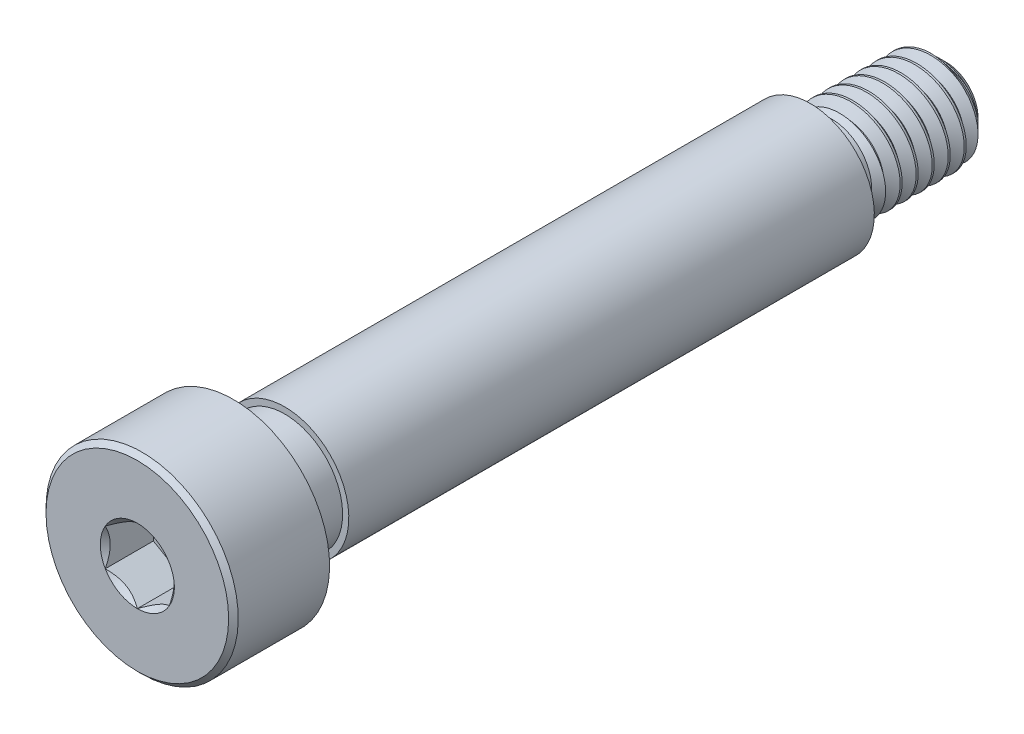
from build123d import *

# Parameters (mm, degrees)
CUT_REVOLVE_THIN1_START         = -8.379
CUT_REVOLVE_THIN1_OUTLINE_R     = 2
CUT_REVOLVE_THIN1_OUTLINE_R_2   = 1.807
CUT_REVOLVE_THIN1_DEPTH         = 16.4
CUT_REVOLVE_THIN1_2_OUTLINE_R   = 2
CUT_REVOLVE_THIN1_2_OUTLINE_R_2 = 1.797
CUT_REVOLVE_THIN1_2_DEPTH       = 16.4
CUT_EXTRUDE1_START              = 12.621
CUT_EXTRUDE1_DEPTH              = 1.5
CHAMFER2_SIZE                   = 0.506148016
CUT_SWEEP1_PITCH                = 0.5
CUT_SWEEP1_TO                   = 3.567136


with BuildPart() as part:
    # Sketch3 → Revolve1 (revolve)
    with BuildSketch(Plane(origin=(0, 0, 0), x_dir=(0, 0, -1), z_dir=(1, 0, 0)), mode=Mode.PRIVATE) as revolve1_sk:
        with BuildLine():
            Line((-12.621, 0), (-12.621, 2.805))
            Line((-12.621, 2.805), (-12.621, 3))
            Line((-12.621, 3), (-9.816, 3))
            Line((-9.816, 3), (-9.621, 3))
            Line((-9.621, 3), (-9.621, 1.797))
            Line((-9.621, 1.797), (-8.021, 1.797))
            Line((-8.021, 1.797), (-8.021, 2))
            Line((-8.021, 2), (8.379, 2))
            Line((8.379, 2), (8.379, 1.36904775))
            ThreePointArc((8.379, 1.36904775), (8.417355026, 1.276450526), (8.50995225, 1.2380955))
            Line((8.50995225, 1.2380955), (9.053864022, 1.2380955))
            Line((9.053864022, 1.2380955), (9.053864022, 1.5))
            Line((9.053864022, 1.5), (12.246, 1.5))
            Line((12.246, 1.5), (12.621, 1.5))
            Line((12.621, 1.5), (12.621, 0))
            Line((12.621, 0), (-12.621, 0))
        make_face()
    revolve(revolve1_sk.sketch.rotate(Axis((0, 0, 12.621), (0, 0, -1)), 180), axis=Axis((0, 0, 12.621), (0, 0, -1)))

    # Cut-Revolve-Thin1 2 outline → Cut-Revolve-Thin1 2 (cut)
    with BuildSketch(Plane.XY.offset(CUT_REVOLVE_THIN1_START)):
        Circle(CUT_REVOLVE_THIN1_2_OUTLINE_R)
        Circle(CUT_REVOLVE_THIN1_2_OUTLINE_R_2, mode=Mode.SUBTRACT)
    extrude(amount=CUT_REVOLVE_THIN1_2_DEPTH, mode=Mode.SUBTRACT)

    # Sketch4 → Cut-Extrude1 (cut)
    with BuildSketch(Plane.XY.offset(CUT_EXTRUDE1_START)):
        Polygon((0, 1.154700538), (-1, 0.577350269), (-1, -0.577350269), (0, -1.154700538), (1, -0.577350269), (1, 0.577350269), align=None)
    extrude(amount=-CUT_EXTRUDE1_DEPTH, mode=Mode.SUBTRACT)

    # Cut-Extrude2 cone 1 section (through the dimple's axis) → Cut-Extrude2 (revolve, cut)
    with BuildSketch(Plane(origin=(0, 0, 12.621), x_dir=(0, -1, 0), z_dir=(1, 0, 0))):
        Polygon((0, 0), (1.154700538, 0), (0, 1.154700538), align=None)
    revolve(axis=Axis((0, 0, 12.621), (0, 0, -1)), mode=Mode.SUBTRACT)

    # Chamfer2
    chamfer2_edges = [part.edges().sort_by_distance(p)[0] for p in [
        (0, 1.5, -12.621),
    ]]
    chamfer(chamfer2_edges, length=CHAMFER2_SIZE)

    # Sketch10 → Cut-Revolve2 (revolve, cut)
    with BuildSketch(Plane(origin=(0, 0, 0), x_dir=(0, 0, -1), z_dir=(1, 0, 0)), mode=Mode.PRIVATE) as cut_revolve2_sk:
        Polygon((-12.621, 2.85), (-12.471, 3), (-12.621, 3), align=None)
    revolve(cut_revolve2_sk.sketch.rotate(Axis((0, 0, 12.621), (0, 0, -1)), 180), axis=Axis((0, 0, 12.621), (0, 0, -1)), mode=Mode.SUBTRACT)


with BuildPart() as body_2:
    # Cut-Revolve-Thin1: read off the stored shape, not the designer's step
    # Cut-Revolve-Thin1 outline → Cut-Revolve-Thin1 (new body)
    with BuildSketch(Plane.XY.offset(CUT_REVOLVE_THIN1_START)):
        Circle(CUT_REVOLVE_THIN1_OUTLINE_R)
        Circle(CUT_REVOLVE_THIN1_OUTLINE_R_2, mode=Mode.SUBTRACT)
    extrude(amount=CUT_REVOLVE_THIN1_DEPTH)


with BuildPart() as body_3:
    # Split1: read off the stored shape, not the designer's step
    # Split1: the piece on the far side of the plane
    add(part.part)
    split(bisect_by=Plane.XY.offset(-9.053864022), keep=Keep.BOTTOM)

    # Cut-Sweep1: arcs per turn and ends read off the stored shape
    # Cut-Sweep1: the profile of Sketch7 screwed along a right-hand helix through 9 turns, 6 arcs to a turn; built about Z, then put on its axis
    cut_sweep1_z = Axis((0, 0, 0), (0, 0, 1))
    cut_sweep1_corners = [(1.527063294, 0, 0.015625), (1.175240474, 0, -0.1875), (1.175240474, 0, -0.25), (1.527063294, 0, -0.453125)]
    with BuildLine(mode=Mode.PRIVATE) as cut_sweep1_profile:
        Line(cut_sweep1_corners[0], cut_sweep1_corners[1])
        Line(cut_sweep1_corners[1], cut_sweep1_corners[2])
        Line(cut_sweep1_corners[2], cut_sweep1_corners[3])
        Line(cut_sweep1_corners[3], cut_sweep1_corners[0])
    cut_sweep1_cap = Face(cut_sweep1_profile.wire())
    cut_sweep1_turn_angles = [0, 30, 60, 90, 120, 150, 180, 210, 240, 270, 300, 330, 360]
    cut_sweep1_turn_weights = [1, 0.8660254037844387, 1, 0.8660254037844387, 1, 0.8660254037844387, 1, 0.8660254037844387, 1, 0.8660254037844387, 1, 0.8660254037844387, 1]
    cut_sweep1_turn_rails = [Edge.make_bspline([Vector(p[0], p[1], 0).rotate(cut_sweep1_z, cut_sweep1_turn_angles[k]) / cut_sweep1_turn_weights[k] + Vector(0, 0, p[2] + CUT_SWEEP1_PITCH * cut_sweep1_turn_angles[k] / 360) for k in range(13)], [0, 0, 0, 1, 1, 2, 2, 3, 3, 4, 4, 5, 5, 6, 6, 6], 2, cut_sweep1_turn_weights) for p in cut_sweep1_corners]
    cut_sweep1_turn_sides = [Face.make_surface_from_curves(cut_sweep1_turn_rails[p[0]], cut_sweep1_turn_rails[p[1]]) for p in [(0, 1), (1, 2), (2, 3), (3, 0)]]
    cut_sweep1 = Plane(origin=(0, 0, -12.621), x_dir=(0, 1, 0), z_dir=(0, 0, 1)) * split(Solid(Shell([*[p.moved(Location((0, 0, CUT_SWEEP1_PITCH * i))) for i in range(9) for p in cut_sweep1_turn_sides], cut_sweep1_cap, cut_sweep1_cap.rotate(cut_sweep1_z, 3240).moved(Location((0, 0, CUT_SWEEP1_PITCH * 3240 / 360)))])), bisect_by=Plane.XY.offset(CUT_SWEEP1_TO), keep=Keep.BOTTOM, mode=Mode.PRIVATE)
    add(cut_sweep1, mode=Mode.SUBTRACT)

    # Sketch11 → Cut-Revolve3 (revolve, cut)
    with BuildSketch(Plane(origin=(0, 0, 0), x_dir=(0, 0, -1), z_dir=(1, 0, 0)), mode=Mode.PRIVATE) as cut_revolve3_sk:
        with BuildLine():
            Line((9.053864022, 1.2380955), (8.50995225, 1.2380955))
            ThreePointArc((8.50995225, 1.2380955), (8.417355026, 1.276450526), (8.379, 1.36904775))
            Line((8.379, 1.36904775), (8.379, 1.5))
            Line((8.379, 1.5), (9.315768522, 1.5))
            Line((9.315768522, 1.5), (9.053864022, 1.2380955))
        make_face()
    revolve(cut_revolve3_sk.sketch.rotate(Axis((0, 0, 12.621), (0, 0, -1)), 180), axis=Axis((0, 0, 12.621), (0, 0, -1)), mode=Mode.SUBTRACT)


with BuildPart() as part_1:
    add(part.part)

    # Split1
    split(bisect_by=Plane.XY.offset(-9.053864022), keep=Keep.TOP)


with BuildPart() as body_3_1:
    add(body_3.part)

    # Combine1: union part
    add(part_1.part)


solid = Compound([body_2.part, body_3_1.part])
